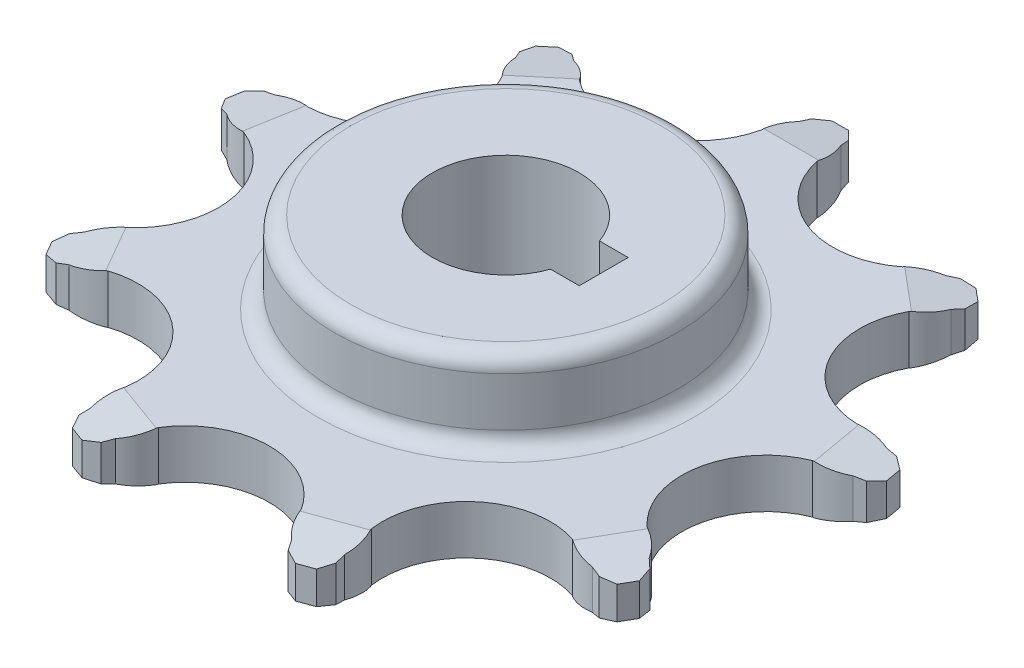
from build123d import *
from OCP.BRepFilletAPI import BRepFilletAPI_MakeChamfer

# Parameters (mm, degrees)
BOSS_EXTRUDE1_DEPTH = 3
SKETCH2_R           = 10.500000000000002
BOSS_EXTRUDE2_DEPTH = 5
FILLET1_R           = 1
FILLET2_R           = 1
BOSS_EXTRUDE3_START = 2
SKETCH4_R           = 10.5
BOSS_EXTRUDE3_DEPTH = 2
FILLET3_R           = 1
FILLET4_R           = 1
CUT_EXTRUDE1_DEPTH  = 10
CHAMFER1_SIZE       = 3
CHAMFER1_SIZE2      = 0.5
CHAMFER2_SIZE       = 0.5
CHAMFER2_SIZE2      = 3


with BuildPart() as part:
    # Sketch1 → Boss-Extrude1 (new body)
    with BuildSketch(Plane(origin=(0, 0, 0), x_dir=(1, 0, 0), z_dir=(0, 1, 0))):
        with BuildLine():
            Line((-1.1361781683937604, 19.87963278842776), (-1.2723563367881987, 19.259265576854713))
            ThreePointArc((-1.2723563367881987, 19.259265576854713), (-1.61675206137744, 18.362202828380155), (-1.679748173200239, 17.40336943319931))
            ThreePointArc((-1.679748173200239, 17.40336943319931), (-4.959292078222066, 13.625543001395792), (-9.899908484538452, 14.411475758975762))
            ThreePointArc((-9.899908484538452, 14.411475758975762), (-10.56449253211368, 15.105491633091315), (-11.404935782999473, 15.571308262094906))
            Line((-11.404935782999473, 15.571308262094906), (-11.908018669226982, 15.9590034778603))
            Line((-11.908018669226982, 15.9590034778603), (-12.794123777014558, 16.025304888782568))
            Line((-12.794123777014558, 16.025304888782568), (-13.177145998574076, 15.703911083939328))
            Line((-13.177145998574076, 15.703911083939328), (-13.560168220133505, 15.382517279095985))
            Line((-13.560168220133505, 15.382517279095985), (-13.64874461381075, 14.498360979781168))
            Line((-13.64874461381075, 14.498360979781168), (-13.354298785928489, 13.935598485308667))
            ThreePointArc((-13.354298785928489, 13.935598485308667), (-13.041500397153213, 13.027035247115714), (-12.47343199237884, 12.252033132723007))
            ThreePointArc((-12.47343199237884, 12.252033132723007), (-12.557368354878863, 7.250000000000451), (-16.847287937141115, 4.676292411418168))
            ThreePointArc((-16.847287937141115, 4.676292411418168), (-17.802493658572583, 4.780753023841534), (-18.74573169818019, 4.597362755687927))
            Line((-18.74573169818019, 4.597362755687927), (-19.380321228631775, 4.570979075436471))
            Line((-19.380321228631775, 4.570979075436471), (-20.101734847916855, 4.0521915186783986))
            Line((-20.101734847916855, 4.0521915186783986), (-20.18855893675035, 3.559787642172294))
            Line((-20.18855893675035, 3.559787642172294), (-20.275383025583707, 3.0673837656661704))
            Line((-20.275383025583707, 3.0673837656661704), (-19.77491176552594, 2.333144937361034))
            Line((-19.77491176552594, 2.333144937361034), (-19.18761641663395, 2.0913099855612147))
            ThreePointArc((-19.18761641663395, 2.0913099855612147), (-18.363985756968965, 1.5963730943559744), (-17.430658355565846, 1.3678343632640542))
            ThreePointArc((-17.430658355565846, 1.3678343632640542), (-14.27971241867698, -2.5178985761701718), (-15.911634127196386, -7.246980126647359))
            ThreePointArc((-15.911634127196386, -7.246980126647359), (-16.710510149506995, -7.78095305741542), (-17.315191416180426, -8.527739878101265))
            Line((-17.315191416180426, -8.527739878101265), (-17.784356096880753, -8.955857237158021))
            Line((-17.784356096880753, -8.955857237158021), (-18.003520777580764, -9.816987298107405))
            Line((-18.003520777580764, -9.816987298107405), (-17.753520777580768, -10.249999999999627))
            Line((-17.753520777580768, -10.249999999999627), (-17.503520777580654, -10.683012701891785))
            Line((-17.503520777580654, -10.683012701891785), (-16.64817792848777, -10.92377555126792))
            Line((-16.64817792848777, -10.92377555126792), (-16.042835079393377, -10.731525698751813))
            ThreePointArc((-16.042835079393377, -10.731525698751813), (-15.093758088131102, -10.581249770963566), (-14.2318859539962, -10.156389306551269))
            ThreePointArc((-14.2318859539962, -10.156389306551269), (-9.320420340454985, -11.107644425224919), (-7.530749871027556, -15.77931012223921))
            ThreePointArc((-7.530749871027556, -15.77931012223921), (-7.799493224853872, -16.701864727446964), (-7.7826806336331344, -17.66261824765509))
            Line((-7.7826806336331344, -17.66261824765509), (-7.866893096297905, -18.29214841522))
            Line((-7.866893096297905, -18.29214841522), (-7.4812592485692155, -19.09268865444786))
            Line((-7.4812592485692155, -19.09268865444786), (-7.011412938176259, -19.2636987261107))
            Line((-7.011412938176259, -19.2636987261107), (-6.541566627783259, -19.434708797773407))
            Line((-6.541566627783259, -19.434708797773407), (-5.731576614822292, -19.06934005521649))
            Line((-5.731576614822292, -19.06934005521649), (-5.391432912253138, -18.532961240995856))
            ThreePointArc((-5.391432912253138, -18.532961240995856), (-4.760993261421028, -17.80778827095715), (-4.373855944757768, -16.92832554413727))
            ThreePointArc((-4.373855944757768, -16.92832554413727), (-2.5873e-13, -14.499999999999906), (4.3738559447571745, -16.928325544137405))
            ThreePointArc((4.3738559447571745, -16.928325544137405), (4.760993261420172, -17.807788270955786), (5.391432912251758, -18.532961240994798))
            Line((5.391432912251758, -18.532961240994798), (5.731576614820664, -19.06934005521577))
            Line((5.731576614820664, -19.06934005521577), (6.541566627782982, -19.434708797773652))
            Line((6.541566627782982, -19.434708797773652), (7.0114129381759405, -19.26369872611082))
            Line((7.0114129381759405, -19.26369872611082), (7.4812592485688505, -19.092688654447862))
            Line((7.4812592485688505, -19.092688654447862), (7.866893096297095, -18.292148415221522))
            Line((7.866893096297095, -18.292148415221522), (7.782680633632731, -17.66261824765671))
            ThreePointArc((7.782680633632731, -17.66261824765671), (7.7994932248540705, -16.701864727448484), (7.530749871027006, -15.779310122239508))
            ThreePointArc((7.530749871027006, -15.779310122239508), (9.320420340454572, -11.107644425225274), (14.23188595399582, -10.156389306551766))
            ThreePointArc((14.23188595399582, -10.156389306551766), (15.093758088129494, -10.581249770962984), (16.04283507939157, -10.731525698751803))
            Line((16.04283507939157, -10.731525698751803), (16.64817792848599, -10.923775551268324))
            Line((16.64817792848599, -10.923775551268324), (17.5035207775806, -10.683012701892142))
            Line((17.5035207775806, -10.683012701892142), (17.753520777580604, -10.249999999999922))
            Line((17.753520777580604, -10.249999999999922), (18.00352077758049, -9.816987298107634))
            Line((18.00352077758049, -9.816987298107634), (17.784356096881123, -8.955857237159611))
            Line((17.784356096881123, -8.955857237159611), (17.315191416181165, -8.52773987810267))
            ThreePointArc((17.315191416181165, -8.52773987810267), (16.71051014950813, -7.780953057416363), (15.911634127196157, -7.246980126647927))
            ThreePointArc((15.911634127196157, -7.246980126647927), (14.279712418676887, -2.5178985761706927), (17.43065835556587, 1.3678343632634447))
            ThreePointArc((17.43065835556587, 1.3678343632634447), (18.363985756967264, 1.5963730943555055), (19.187616416632455, 2.091309985560174))
            Line((19.187616416632455, 2.091309985560174), (19.774911765524735, 2.3331449373596937))
            Line((19.774911765524735, 2.3331449373596937), (20.275383025583377, 3.0673837656658103))
            Line((20.275383025583377, 3.0673837656658103), (20.188558936749914, 3.559787642171918))
            Line((20.188558936749914, 3.559787642171918), (20.101734847916315, 4.052191518678001))
            Line((20.101734847916315, 4.052191518678001), (19.380321228632635, 4.570979075435552))
            Line((19.380321228632635, 4.570979075435552), (18.74573169818122, 4.597362755687423))
            ThreePointArc((18.74573169818122, 4.597362755687423), (17.802493658573834, 4.78075302384167), (16.847287937134777, 4.676292411414891))
            ThreePointArc((16.847287937134777, 4.676292411414891), (12.557368354874384, 7.249999999999774), (12.473431992377382, 12.252033132722048))
            ThreePointArc((12.473431992377382, 12.252033132722048), (13.041500397151985, 13.027035247114444), (13.354298785927934, 13.935598485306992))
            Line((13.354298785927934, 13.935598485306992), (13.648744613810612, 14.498360979779449))
            Line((13.648744613810612, 14.498360979779449), (13.560168220133354, 15.382517279095445))
            Line((13.560168220133354, 15.382517279095445), (13.177145998573863, 15.703911083938719))
            Line((13.177145998573863, 15.703911083938719), (12.794123777014287, 16.025304888781886))
            Line((12.794123777014287, 16.025304888781886), (11.908018669228412, 15.959003477860701))
            Line((11.908018669228412, 15.959003477860701), (11.404935783000788, 15.571308262095705))
            ThreePointArc((11.404935783000788, 15.571308262095705), (10.564492532114471, 15.105491633092715), (9.899908484538779, 14.411475758975572))
            ThreePointArc((9.899908484538779, 14.411475758975572), (4.959292078222331, 13.625543001395524), (1.6797481732004549, 17.403369433199202))
            ThreePointArc((1.6797481732004549, 17.403369433199202), (1.6167520613771744, 18.362202828378468), (1.272356336788733, 19.259265576853146))
            Line((1.272356336788733, 19.259265576853146), (1.1361781683946401, 19.879632788426427))
            Line((1.1361781683946401, 19.879632788426427), (0.5000000000000316, 20.499999999999623))
            Line((0.5000000000000316, 20.499999999999623), (-1.246e-14, 20.50000000000019))
            Line((-1.246e-14, 20.50000000000019), (-0.500000000000012, 20.500000000000096))
            Line((-0.500000000000012, 20.500000000000096), (-1.1361781683937604, 19.87963278842776))
        make_face()
    extrude(amount=BOSS_EXTRUDE1_DEPTH)

    # Sketch2 → Boss-Extrude2 (add)
    with BuildSketch(Plane(origin=(0, 3, 0), x_dir=(1, 0, 0), z_dir=(0, 1, 0))):
        with Locations(Location((0, 0, 0), (0, 0, 270))):
            Circle(SKETCH2_R)
    extrude(amount=BOSS_EXTRUDE2_DEPTH)

    # Fillet1
    fillet1_edges = [part.edges().sort_by_distance(p)[0] for p in [
        (-1.45e-15, 3, -10.500000000000002),
    ]]
    fillet(fillet1_edges, radius=FILLET1_R)

    # Fillet2
    fillet2_edges = [part.edges().sort_by_distance(p)[0] for p in [
        (-1.45e-15, 8, -10.500000000000002),
    ]]
    fillet(fillet2_edges, radius=FILLET2_R)

    # Sketch4 → Boss-Extrude3 (add)
    with BuildSketch(Plane.XZ.offset(BOSS_EXTRUDE3_START)):
        with Locations(Location((0, 0, 0), (0, 0, 90))):
            Circle(SKETCH4_R)
    extrude(amount=-BOSS_EXTRUDE3_DEPTH)

    # Fillet3
    fillet3_edges = [part.edges().sort_by_distance(p)[0] for p in [
        (-1.93e-15, 0, -10.5),
    ]]
    fillet(fillet3_edges, radius=FILLET3_R)

    # Fillet4
    fillet4_edges = [part.edges().sort_by_distance(p)[0] for p in [
        (-1.93e-15, -2, -10.5),
    ]]
    fillet(fillet4_edges, radius=FILLET4_R - 0.0001)  # a hair under: the kernel refuses the full size

    # Sketch3 → Cut-Extrude1 (cut)
    with BuildSketch(Plane(origin=(0, 8, 0), x_dir=(1, 0, 0), z_dir=(0, 1, 0))):
        with BuildLine():
            Line((6, 0), (6, 1.5))
            Line((6, 1.5), (4.242640687119285, 1.4999999999999996))
            ThreePointArc((4.242640687119285, 1.4999999999999996), (-4.499999999999999, 5.5e-16), (4.242640687119285, -1.4999999999999996))
            Line((4.242640687119285, -1.4999999999999996), (6, -1.4999999999999991))
            Line((6, -1.4999999999999991), (6, 0))
        make_face()
    extrude(amount=-CUT_EXTRUDE1_DEPTH, mode=Mode.SUBTRACT)

    # Chamfer1
    chamfer1_edges = [part.edges().sort_by_distance(p)[0] for p in [
        (17.753520777580547, 3, 10.249999999999888),
        (-17.75352077758071, 3, 10.249999999999595),
        (-7.011412938176237, 3, 19.263698726110633),
        (7.011412938175916, 3, 19.263698726110757),
        (-20.188558936750283, 3, -3.5597876421722843),
        (-13.177145998574032, 3, -15.703911083939277),
        (0.2500000000000096, 3, -20.499999999999908),
        (13.17714599857382, 3, -15.703911083938666),
        (20.188558936749846, 3, -3.5597876421719055),
    ]]
    chamfer1_side = [part.faces().sort_by_distance(p)[0] for p in [
        (3.7e-15, 3, -12.069134921973648),
    ]]
    chamfer(chamfer1_edges, length=CHAMFER1_SIZE, length2=CHAMFER1_SIZE2, reference=chamfer1_side[0])

    # Chamfer2: one chamfer whose edges measure the first distance from different faces: ONE call of the kernel's chamfer builder (chamfer() names one face for all edges)
    chamfer2_edges_1 = [part.edges().sort_by_distance(p)[0] for p in [
        (17.753520777580547, 0, 10.249999999999888),
    ]]
    chamfer2_side_1 = [part.faces().sort_by_distance(p)[0] for p in [
        (17.753520777580604, 1.2500000000000002, 10.249999999999922),
    ]]
    chamfer2_edges_2 = [part.edges().sort_by_distance(p)[0] for p in [
        (7.0114129381759165, 0, 19.263698726110757),
    ]]
    chamfer2_side_2 = [part.faces().sort_by_distance(p)[0] for p in [
        (7.01141293817594, 1.2500000000000002, 19.26369872611082),
    ]]
    chamfer2_edges_3 = [part.edges().sort_by_distance(p)[0] for p in [
        (-7.011412938176237, 0, 19.263698726110633),
    ]]
    chamfer2_side_3 = [part.faces().sort_by_distance(p)[0] for p in [
        (-7.011412938176261, 1.25, 19.2636987261107),
    ]]
    chamfer2_edges_4 = [part.edges().sort_by_distance(p)[0] for p in [
        (-17.753520777580707, 0, 10.249999999999595),
    ]]
    chamfer2_side_4 = [part.faces().sort_by_distance(p)[0] for p in [
        (-17.753520777580768, 1.25, 10.249999999999629),
    ]]
    chamfer2_edges_5 = [part.edges().sort_by_distance(p)[0] for p in [
        (-20.188558936750283, 0, -3.5597876421722843),
    ]]
    chamfer2_side_5 = [part.faces().sort_by_distance(p)[0] for p in [
        (-20.18855893675035, 1.2500000000000002, -3.5597876421722967),
    ]]
    chamfer2_edges_6 = [part.edges().sort_by_distance(p)[0] for p in [
        (-13.177145998574032, 0, -15.703911083939277),
    ]]
    chamfer2_side_6 = [part.faces().sort_by_distance(p)[0] for p in [
        (-13.177145998574076, 1.25, -15.703911083939326),
    ]]
    chamfer2_edges_7 = [part.edges().sort_by_distance(p)[0] for p in [
        (0.2500000000000096, 0, -20.499999999999908),
    ]]
    chamfer2_side_7 = [part.faces().sort_by_distance(p)[0] for p in [
        (0.2500000000000096, 1.25, -20.499999999999904),
    ]]
    chamfer2_edges_8 = [part.edges().sort_by_distance(p)[0] for p in [
        (13.17714599857382, 0, -15.703911083938666),
    ]]
    chamfer2_side_8 = [part.faces().sort_by_distance(p)[0] for p in [
        (13.177145998573865, 1.2500000000000002, -15.703911083938717),
    ]]
    chamfer2_edges_9 = [part.edges().sort_by_distance(p)[0] for p in [
        (20.188558936749846, 0, -3.5597876421719055),
    ]]
    chamfer2_side_9 = [part.faces().sort_by_distance(p)[0] for p in [
        (20.188558936749914, 1.25, -3.5597876421719175),
    ]]
    chamfer2 = BRepFilletAPI_MakeChamfer(part.part.solid().wrapped)
    for e in chamfer2_edges_1:
        chamfer2.Add(CHAMFER2_SIZE, CHAMFER2_SIZE2, e.wrapped, chamfer2_side_1[0].wrapped)  # the first distance lies on this face
    for e in chamfer2_edges_2:
        chamfer2.Add(CHAMFER2_SIZE, CHAMFER2_SIZE2, e.wrapped, chamfer2_side_2[0].wrapped)  # the first distance lies on this face
    for e in chamfer2_edges_3:
        chamfer2.Add(CHAMFER2_SIZE, CHAMFER2_SIZE2, e.wrapped, chamfer2_side_3[0].wrapped)  # the first distance lies on this face
    for e in chamfer2_edges_4:
        chamfer2.Add(CHAMFER2_SIZE, CHAMFER2_SIZE2, e.wrapped, chamfer2_side_4[0].wrapped)  # the first distance lies on this face
    for e in chamfer2_edges_5:
        chamfer2.Add(CHAMFER2_SIZE, CHAMFER2_SIZE2, e.wrapped, chamfer2_side_5[0].wrapped)  # the first distance lies on this face
    for e in chamfer2_edges_6:
        chamfer2.Add(CHAMFER2_SIZE, CHAMFER2_SIZE2, e.wrapped, chamfer2_side_6[0].wrapped)  # the first distance lies on this face
    for e in chamfer2_edges_7:
        chamfer2.Add(CHAMFER2_SIZE, CHAMFER2_SIZE2, e.wrapped, chamfer2_side_7[0].wrapped)  # the first distance lies on this face
    for e in chamfer2_edges_8:
        chamfer2.Add(CHAMFER2_SIZE, CHAMFER2_SIZE2, e.wrapped, chamfer2_side_8[0].wrapped)  # the first distance lies on this face
    for e in chamfer2_edges_9:
        chamfer2.Add(CHAMFER2_SIZE, CHAMFER2_SIZE2, e.wrapped, chamfer2_side_9[0].wrapped)  # the first distance lies on this face
    add(Compound.cast(chamfer2.Shape()), mode=Mode.REPLACE)


solid = part.part
